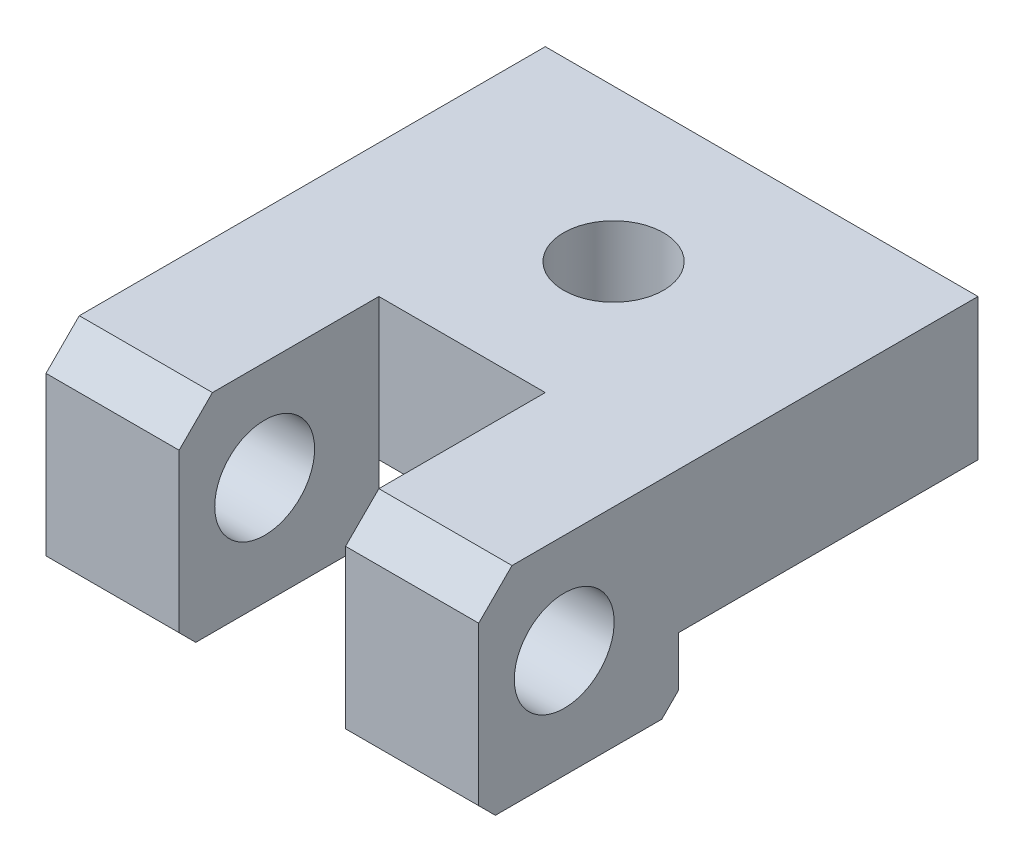
from build123d import *

# Parameters (mm, degrees)
SKETCH_1_W            = 30
SKETCH_1_H            = 13.5
EXTRUDE_1_DEPTH       = 20
SKETCH_2_W            = 10
SKETCH_2_H            = 20.163242361
CUT_EXTRUDE_2_DEPTH   = 29.41214529
SKETCH_3_R            = 3
CUT_EXTRUDE_3_DEPTH   = 37.827299657
SKETCH_6_W            = 30
SKETCH_6_H            = 13.5
EXTRUDE_5_DEPTH       = 10
SKETCH_7_R            = 3
CUT_EXTRUDE_1_DEPTH   = 29.41214529
SKETCH_8_W            = 30
SKETCH_8_H            = 18
CUT_EXTRUDE_2_2_DEPTH = 5
CHAMFER_1_SIZE        = 2
SKETCH_9_W            = 6.52399098
SKETCH_9_H            = 33.458140235
CUT_EXTRUDE_6_DEPTH   = 29.41214529
SKETCH_14_W           = 84.903926308
SKETCH_14_H           = 44.963333207
CUT_EXTRUDE_10_DEPTH  = 1
SKETCH_15_R           = 2.000000004
CUT_EXTRUDE_3_2_DEPTH = 16


with BuildPart() as part:
    # Эскиз1 → Вытянуть1 (new body)
    with BuildSketch(Plane.XY):
        with Locations((0, -0.75)):
            Rectangle(SKETCH_1_W, SKETCH_1_H)
    extrude(amount=EXTRUDE_1_DEPTH)

    # Эскиз2 → Cut-Extrude 2 (cut, through all)
    with BuildSketch(Plane.XZ.offset(7.5)):
        with Locations((0, 18.081621181)):
            Rectangle(SKETCH_2_W, SKETCH_2_H)
    extrude(amount=-CUT_EXTRUDE_2_DEPTH, mode=Mode.SUBTRACT)

    # Эскиз3 → Cut-Extrude 3 (cut, through all)
    with BuildSketch(Plane(origin=(15, 0, 0), x_dir=(0, 0, -1), z_dir=(1, 0, 0))):
        with Locations((-14.861357689, 0)):
            Circle(SKETCH_3_R)
    extrude(amount=-CUT_EXTRUDE_3_DEPTH, mode=Mode.SUBTRACT)

    # Эскиз6 → Вытянуть5 (add)
    with BuildSketch(Plane(origin=(0, 0, 0), x_dir=(-1, 0, 0), z_dir=(0, 0, -1))):
        with Locations((0, -0.75)):
            Rectangle(SKETCH_6_W, SKETCH_6_H)
    extrude(amount=EXTRUDE_5_DEPTH)

    # Эскиз7 → Вырез-Вытянуть1 (cut, through all)
    with BuildSketch(Plane(origin=(0, 6, 0), x_dir=(1, 0, 0), z_dir=(0, 1, 0))):
        with Locations((0.231400022, 0.869933179)):
            Circle(SKETCH_7_R)
    extrude(amount=-CUT_EXTRUDE_1_DEPTH, mode=Mode.SUBTRACT)

    # Эскиз8 → Cut-Extrude 2 2 (cut)
    with BuildSketch(Plane.XZ.offset(7.5)):
        with Locations((0, -1)):
            Rectangle(SKETCH_8_W, SKETCH_8_H)
    extrude(amount=-CUT_EXTRUDE_2_2_DEPTH, mode=Mode.SUBTRACT)

    # Фаска1
    chamfer_1_edges = [part.edges().sort_by_distance(p)[0] for p in [
        (10, 6, 20),
        (10, -7.5, 20),
        (-10, 6, 20),
        (-10, -7.5, 20),
        (-10, -7.5, 8),
        (10, -7.5, 8),
    ]]
    chamfer(chamfer_1_edges, length=CHAMFER_1_SIZE)

    # Эскиз9 → Вытянуть6 (cut, through all)
    with BuildSketch(Plane(origin=(0, 6, 0), x_dir=(1, 0, 0), z_dir=(0, 1, 0))):
        with Locations((16.26199549, -3.329208479)):
            Rectangle(SKETCH_9_W, SKETCH_9_H)
        with Locations((-16.26199549, -3.329208479)):
            Rectangle(SKETCH_9_W, SKETCH_9_H)
    extrude(amount=-CUT_EXTRUDE_6_DEPTH, mode=Mode.SUBTRACT)

    # Эскиз14 → Вытянуть10 (cut)
    with BuildSketch(Plane.XZ.offset(7.5)):
        with Locations((0.061866905, -0.327668242)):
            Rectangle(SKETCH_14_W, SKETCH_14_H)
    extrude(amount=-CUT_EXTRUDE_10_DEPTH, mode=Mode.SUBTRACT)

    # Эскиз15 → Cut-Extrude 3 2 (cut)
    with BuildSketch(Plane(origin=(0, 0, -10), x_dir=(-1, 0, 0), z_dir=(0, 0, -1))):
        with Locations((-7.999999896, 1.748498224)):
            Circle(SKETCH_15_R)
        with Locations((8.000000104, 1.750000003)):
            Circle(SKETCH_15_R)
    extrude(amount=-CUT_EXTRUDE_3_2_DEPTH, mode=Mode.SUBTRACT)


solid = part.part
